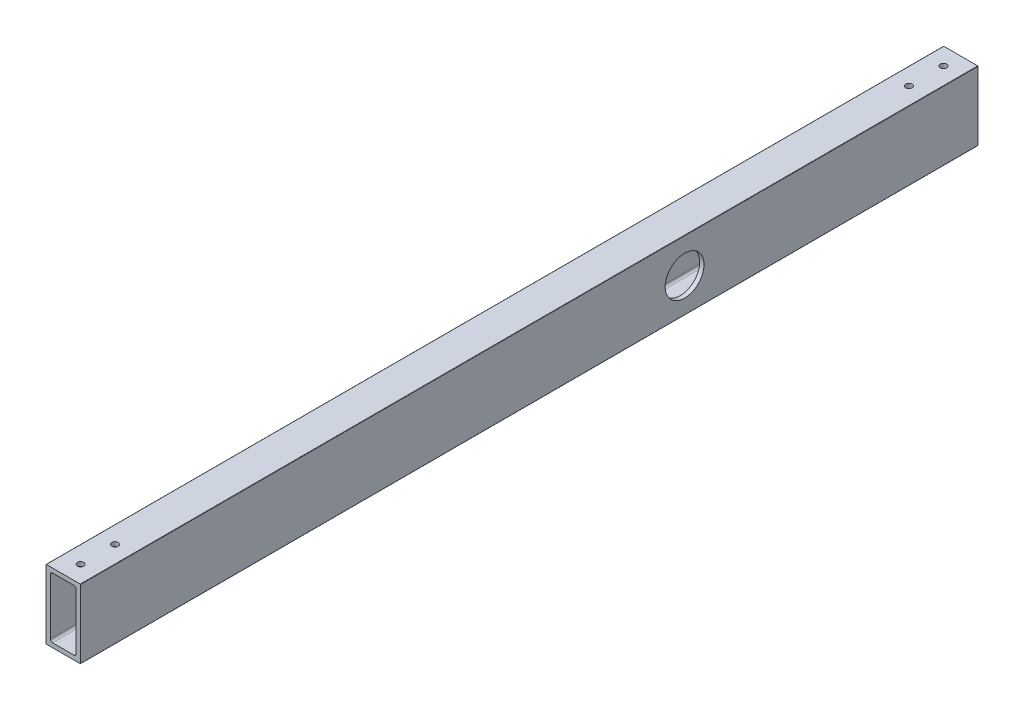
from build123d import *

# Parameters (mm, degrees)
BOSS_EXTRUDE1_DEPTH = 660.4
SKETCH2_R           = 2.38125
CUT_EXTRUDE1_DEPTH  = 663.837808216
SKETCH5_R           = 14.2875
CUT_EXTRUDE2_DEPTH  = 663.837808216


with BuildPart() as part:
    # Sketch1 → Boss-Extrude1 (new body)
    with BuildSketch(Plane(origin=(0, 0, 0), x_dir=(-1, 0, 0), z_dir=(0, 0, -1))):
        with BuildLine():
            Line((0, 0.254), (0, 50.546))
            ThreePointArc((0, 50.546), (-0.074394878, 50.725605122), (-0.254, 50.8))
            Line((-0.254, 50.8), (-25.146, 50.8))
            ThreePointArc((-25.146, 50.8), (-25.325605122, 50.725605122), (-25.4, 50.546))
            Line((-25.4, 50.546), (-25.4, 0.254))
            ThreePointArc((-25.4, 0.254), (-25.325605122, 0.074394878), (-25.146, 0))
            Line((-25.146, 0), (-0.254, 0))
            ThreePointArc((-0.254, 0), (-0.074394878, 0.074394878), (0, 0.254))
        make_face()
        with BuildLine():
            Line((-3.175, 46.0375), (-3.175, 4.7625))
            ThreePointArc((-3.175, 4.7625), (-3.639967985, 3.639967985), (-4.7625, 3.175))
            Line((-4.7625, 3.175), (-20.6375, 3.175))
            ThreePointArc((-20.6375, 3.175), (-21.760032015, 3.639967985), (-22.225, 4.7625))
            Line((-22.225, 4.7625), (-22.225, 46.0375))
            ThreePointArc((-22.225, 46.0375), (-21.760032015, 47.160032015), (-20.6375, 47.625))
            Line((-20.6375, 47.625), (-4.7625, 47.625))
            ThreePointArc((-4.7625, 47.625), (-3.639967985, 47.160032015), (-3.175, 46.0375))
        make_face(mode=Mode.SUBTRACT)
    extrude(amount=-BOSS_EXTRUDE1_DEPTH)

    # Sketch2 → Cut-Extrude1 (cut, through all)
    with BuildSketch(Plane(origin=(0, 50.8, 0), x_dir=(1, 0, 0), z_dir=(0, 1, 0))):
        with Locations((12.7, -647.7)):
            Circle(SKETCH2_R)
        with Locations((12.7, -622.3)):
            Circle(SKETCH2_R)
        with Locations((12.7, -38.1)):
            Circle(SKETCH2_R)
        with Locations((12.7, -12.7)):
            Circle(SKETCH2_R)
    extrude(amount=-CUT_EXTRUDE1_DEPTH, mode=Mode.SUBTRACT)

    # Sketch5 → Cut-Extrude2 (cut, through all)
    with BuildSketch(Plane(origin=(25.4, 0, 0), x_dir=(0, 0, -1), z_dir=(1, 0, 0))):
        with Locations((-215.9, 25.146)):
            Circle(SKETCH5_R)
    extrude(amount=-CUT_EXTRUDE2_DEPTH, mode=Mode.SUBTRACT)


solid = part.part
